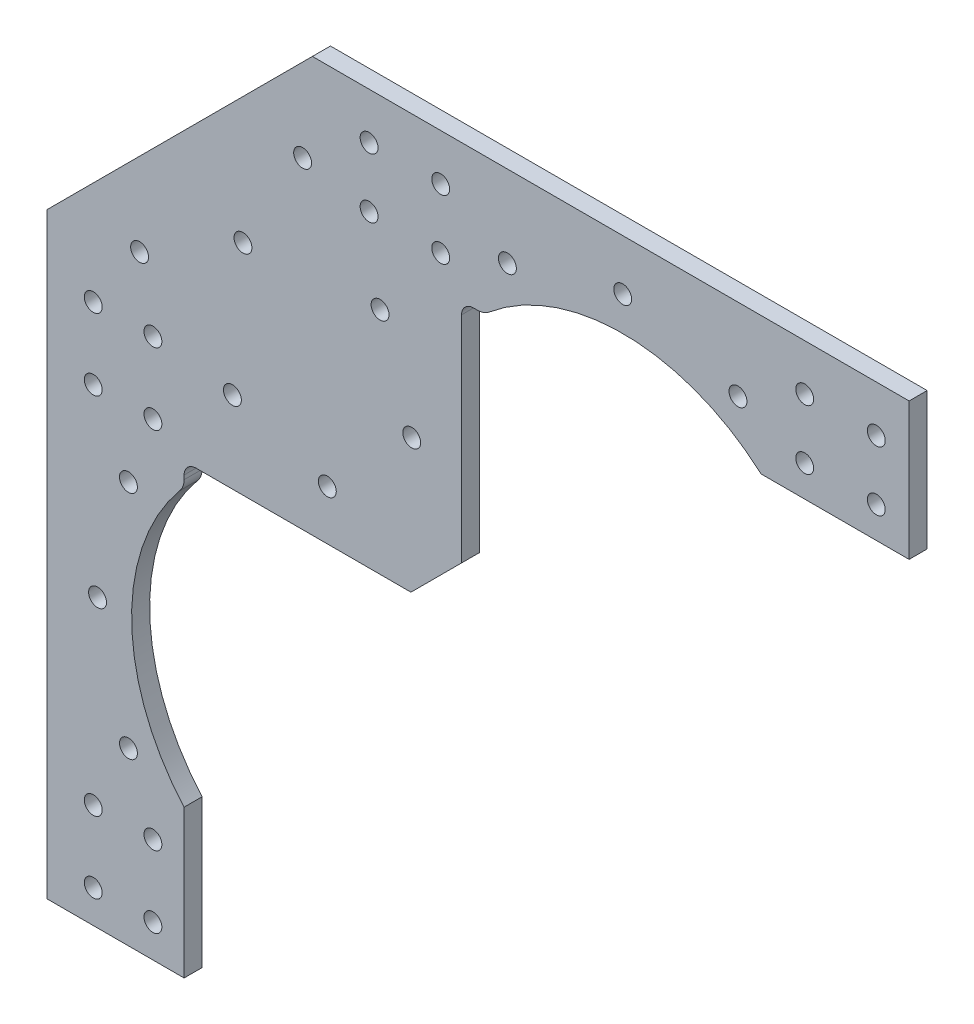
from build123d import *

# Parameters (mm, degrees)
BOSS_EXTRUDE1_DEPTH = 3.0226
SKETCH3_R           = 1.5
CUT_EXTRUDE1_DEPTH  = 10
SKETCH4_R           = 1.5
CUT_EXTRUDE2_DEPTH  = 137.505077234


with BuildPart() as part:
    # Sketch1 → Boss-Extrude1 (new body)
    with BuildSketch(Plane.XY):
        with BuildLine():
            Line((-96.5, -48), (-73.5, -48))
            Line((-73.5, -48), (-73.5, -23.206895527))
            ThreePointArc((-73.5, -23.206895527), (-82.295939504, -0.533121187), (-74.194736842, 22.398060858))
            ThreePointArc((-74.194736842, 22.398060858), (-73.679025924, 23.297059075), (-73.5, 24.317894646))
            Line((-73.5, 24.317894646), (-73.5, 25))
            ThreePointArc((-73.5, 25), (-72.914213562, 26.414213562), (-71.5, 27))
            Line((-71.5, 27), (-35.485281374, 27))
            Line((-35.485281374, 27), (-27, 35.485281374))
            Line((-27, 35.485281374), (-27, 71.5))
            ThreePointArc((-27, 71.5), (-26.414213562, 72.914213562), (-25, 73.5))
            Line((-25, 73.5), (-24.317894646, 73.5))
            ThreePointArc((-24.317894646, 73.5), (-23.297059075, 73.679025924), (-22.398060858, 74.194736842))
            ThreePointArc((-22.398060858, 74.194736842), (0.533121187, 82.295939504), (23.206895527, 73.5))
            Line((23.206895527, 73.5), (48, 73.5))
            Line((48, 73.5), (48, 96.5))
            Line((48, 96.5), (-52, 96.5))
            Line((-52, 96.5), (-96.5, 52))
            Line((-96.5, 52), (-96.5, -48))
        make_face()
    extrude(amount=BOSS_EXTRUDE1_DEPTH)

    # Sketch3 → Cut-Extrude1 (cut)
    with BuildSketch(Plane.XY.offset(3.0226)):
        with Locations((30.5, 78.72592343)):
            Circle(SKETCH3_R)
        with Locations((30.5, 88.72592343)):
            Circle(SKETCH3_R)
        with Locations((42.5, 88.72592343)):
            Circle(SKETCH3_R)
        with Locations((42.5, 78.72592343)):
            Circle(SKETCH3_R)
        with Locations((-42.5, 78.72592343)):
            Circle(SKETCH3_R)
        with Locations((-42.5, 88.72592343)):
            Circle(SKETCH3_R)
        with Locations((-30.5, 88.72592343)):
            Circle(SKETCH3_R)
        with Locations((-30.5, 78.72592343)):
            Circle(SKETCH3_R)
        with Locations((-88.72592343, 30.5)):
            Circle(SKETCH3_R)
        with Locations((-88.72592343, 42.5)):
            Circle(SKETCH3_R)
        with Locations((-78.72592343, 42.5)):
            Circle(SKETCH3_R)
        with Locations((-78.72592343, 30.5)):
            Circle(SKETCH3_R)
        with Locations((-88.72592343, -42.5)):
            Circle(SKETCH3_R)
        with Locations((-88.72592343, -30.5)):
            Circle(SKETCH3_R)
        with Locations((-78.72592343, -30.5)):
            Circle(SKETCH3_R)
        with Locations((-78.72592343, -42.5)):
            Circle(SKETCH3_R)
    extrude(amount=-CUT_EXTRUDE1_DEPTH, mode=Mode.SUBTRACT)

    # Sketch4 → Cut-Extrude2 (cut, through all)
    with BuildSketch(Plane.XY.offset(3.0226)):
        with Locations((-88, 0)):
            Circle(SKETCH4_R)
        with Locations((-63.639610307, 63.639610307)):
            Circle(SKETCH4_R)
        with Locations((0, 88)):
            Circle(SKETCH4_R)
        with Locations((-80.960118382, 53.639610307)):
            Circle(SKETCH4_R)
        with Locations((-53.639610307, 80.960118382)):
            Circle(SKETCH4_R)
        with Locations((19.318516526, 82.823619098)):
            Circle(SKETCH4_R)
        with Locations((-19.318516526, 82.823619098)):
            Circle(SKETCH4_R)
        with Locations((-82.823619098, 19.318516526)):
            Circle(SKETCH4_R)
        with Locations((-82.823619098, -19.318516526)):
            Circle(SKETCH4_R)
        with Locations((-40.658639918, 65.40737726)):
            Circle(SKETCH4_R)
        with Locations((-65.40737726, 40.658639918)):
            Circle(SKETCH4_R)
        with Locations((-49.497474683, 35.355339059)):
            Circle(SKETCH4_R)
        with Locations((-35.355339059, 49.497474683)):
            Circle(SKETCH4_R)
    extrude(amount=-CUT_EXTRUDE2_DEPTH, mode=Mode.SUBTRACT)


solid = part.part
